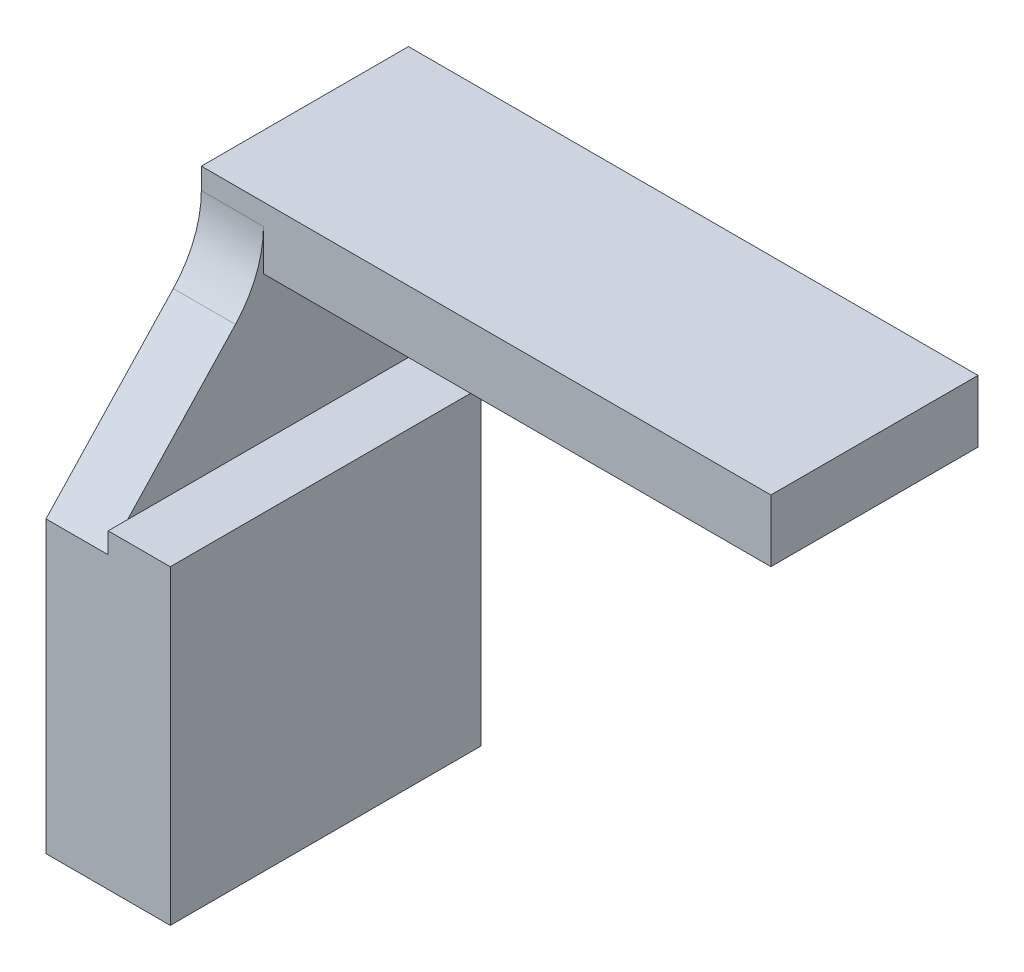
from build123d import *

# Parameters (mm, degrees)
SKETCH1_W           = 55
SKETCH1_H           = 20
BOSS_EXTRUDE1_DEPTH = 6
BOSS_EXTRUDE2_DEPTH = 6
FILLET1_R           = 10
SKETCH3_W           = 30
SKETCH3_H           = 30
BOSS_EXTRUDE3_DEPTH = 6


with BuildPart() as part:
    # Sketch1 → Boss-Extrude1 (new body)
    with BuildSketch(Plane(origin=(0, 0, 0), x_dir=(1, 0, 0), z_dir=(0, 1, 0))):
        Rectangle(SKETCH1_W, SKETCH1_H)
    extrude(amount=BOSS_EXTRUDE1_DEPTH)

    # Sketch2 → Boss-Extrude2 (add)
    with BuildSketch(Plane.ZY.offset(27.5)):
        Polygon((10, 0), (-10, 0), (-5, -5), (-5, -44), (25, -44), (25, -16), align=None)
    extrude(amount=-BOSS_EXTRUDE2_DEPTH)

    # Fillet1
    fillet1_edges = [part.edges().sort_by_distance(p)[0] for p in [
        (-24.5, 0, 10),
    ]]
    fillet(fillet1_edges, radius=FILLET1_R)

    # Sketch3 → Boss-Extrude3 (add)
    with BuildSketch(Plane(origin=(-21.5, 0, 0), x_dir=(0, 0, -1), z_dir=(1, 0, 0))):
        with Locations((-10, -29)):
            Rectangle(SKETCH3_W, SKETCH3_H)
    extrude(amount=BOSS_EXTRUDE3_DEPTH)


solid = part.part
